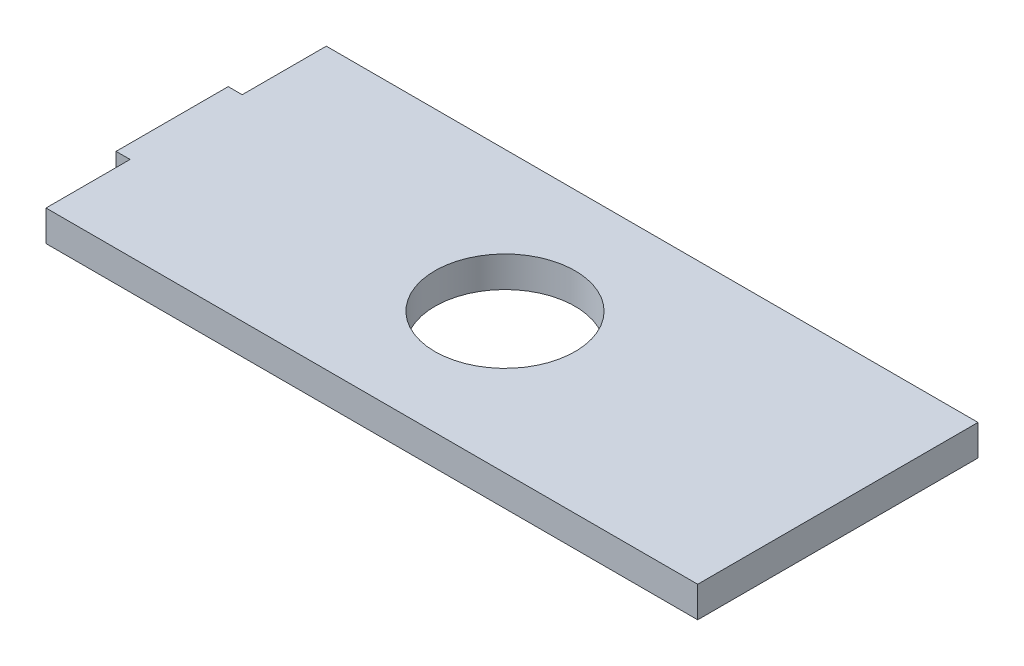
from build123d import *

# Parameters (mm, degrees)
SKETCH1_R           = 5
BOSS_EXTRUDE1_DEPTH = 2.2


with BuildPart() as part:
    # Sketch1 → Boss-Extrude1 (new body)
    with BuildSketch(Plane(origin=(0, 0, 0), x_dir=(1, 0, 0), z_dir=(0, 1, 0))):
        Polygon((-88.695425431, -23.134095761), (-89.695425431, -23.134095761), (-89.695425431, -31.134095761), (-88.695425431, -31.134095761), (-88.695425431, -37.134095761), (-42.195425431, -37.134095761), (-42.195425431, -30.134095761), (-42.195425431, -24.134095761), (-42.195425431, -17.134095761), (-88.695425431, -17.134095761), align=None)
        with Locations((-65.945425431, -27.134095761)):
            Circle(SKETCH1_R, mode=Mode.SUBTRACT)
    extrude(amount=BOSS_EXTRUDE1_DEPTH)


solid = part.part
